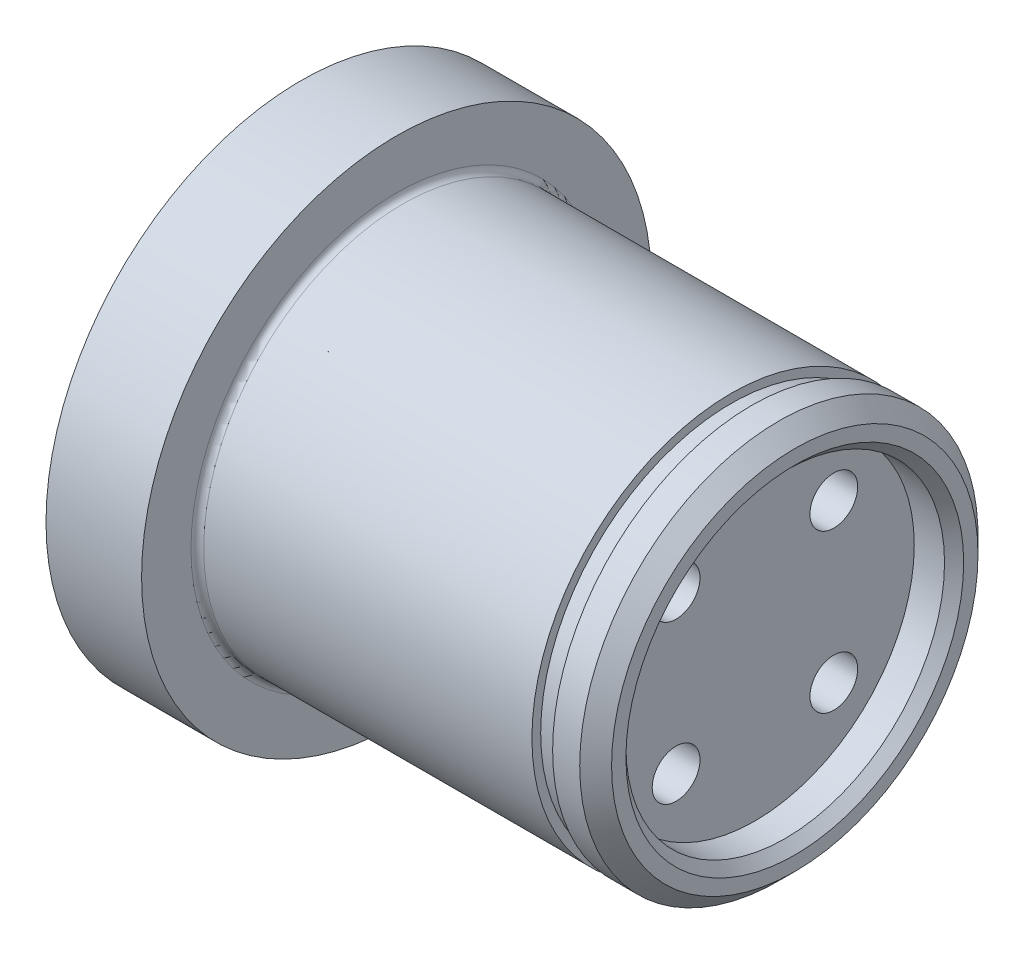
from build123d import *

# Parameters (mm, degrees)
SKETCH_2_W               = 1.3
SKETCH_2_H               = 0.55
CHAMFER_1_SIZE           = 1
FILLET_1_R               = 0.4
HOLE_WIZARD_1_D          = 3
PATTERN_CIRCULAR_1_COUNT = 4
SKETCH_5_W               = 2.5
SKETCH_5_H               = 10
CHAMFER_2_SIZE           = 0.6


with BuildPart() as part:
    # Эскиз1 → Повернуть1 (revolve)
    with BuildSketch(Plane.XY):
        Polygon((0, 0), (0, 12.5), (-25, 12.5), (-25, 16), (-31, 16), (-31, 0), align=None)
    revolve(axis=Axis((0, 0, 0), (1, 0, 0)))

    # Эскиз2 → Вырез-Повернуть1 (revolve, cut)
    with BuildSketch(Plane.XY):
        with Locations((-3.35, 12.225)):
            Rectangle(SKETCH_2_W, SKETCH_2_H)
    revolve(axis=Axis((0, 0, 0), (-1, 0, 0)), mode=Mode.SUBTRACT)

    # Фаска1
    chamfer_1_edges = [part.edges().sort_by_distance(p)[0] for p in [
        (0, -12.5, 0),
    ]]
    chamfer(chamfer_1_edges, length=CHAMFER_1_SIZE)

    # Скругление1
    fillet_1_edges = [part.edges().sort_by_distance(p)[0] for p in [
        (-25, -12.5, 0),
    ]]
    fillet(fillet_1_edges, radius=FILLET_1_R)

    # Отверстие1 (through all)
    with Locations(Plane(origin=(0, 0, 0), x_dir=(0, 0, -1), z_dir=(1, 0, 0))):
        with Locations((4.949747468, 4.949747468)):
            hole_wizard_1 = Hole(HOLE_WIZARD_1_D / 2)

    # Круговой массив1: Отверстие1 ×4 about axis
    pattern_circular_1_axis = Axis((0, 0, 0), (-1, 0, 0))
    for i in range(1, PATTERN_CIRCULAR_1_COUNT):
        add(hole_wizard_1.rotate(pattern_circular_1_axis, i * 360 / PATTERN_CIRCULAR_1_COUNT), mode=Mode.SUBTRACT)

    # Эскиз5 → Вырез-Повернуть2 (revolve, cut)
    with BuildSketch(Plane.XY):
        with Locations((-1.25, 5)):
            Rectangle(SKETCH_5_W, SKETCH_5_H)
    revolve(axis=Axis((0, 0, 0), (-1, 0, 0)), mode=Mode.SUBTRACT)

    # Фаска2
    chamfer_2_edges = [part.edges().sort_by_distance(p)[0] for p in [
        (0, -10, 0),
    ]]
    chamfer(chamfer_2_edges, length=CHAMFER_2_SIZE)


solid = part.part
